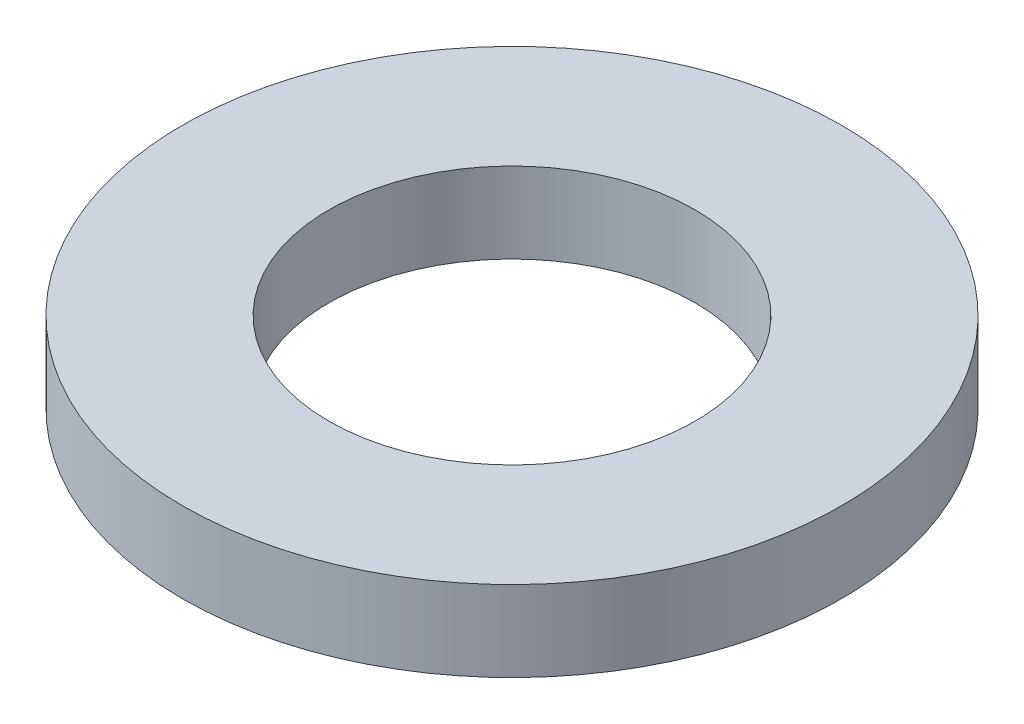
from build123d import *

# Parameters (mm, degrees)
SKETCH1_R           = 90
BOSS_EXTRUDE1_DEPTH = 22
SKETCH2_R           = 50
CUT_EXTRUDE1_DEPTH  = 130.16655914


with BuildPart() as part:
    # Sketch1 → Boss-Extrude1 (new body)
    with BuildSketch(Plane(origin=(0, 0, 0), x_dir=(1, 0, 0), z_dir=(0, 1, 0))):
        Circle(SKETCH1_R)
    extrude(amount=BOSS_EXTRUDE1_DEPTH)

    # Sketch2 → Cut-Extrude1 (cut, through all)
    with BuildSketch(Plane(origin=(0, 0, 0), x_dir=(1, 0, 0), z_dir=(0, 1, 0))):
        Circle(SKETCH2_R)
    extrude(amount=CUT_EXTRUDE1_DEPTH, mode=Mode.SUBTRACT)


solid = part.part
